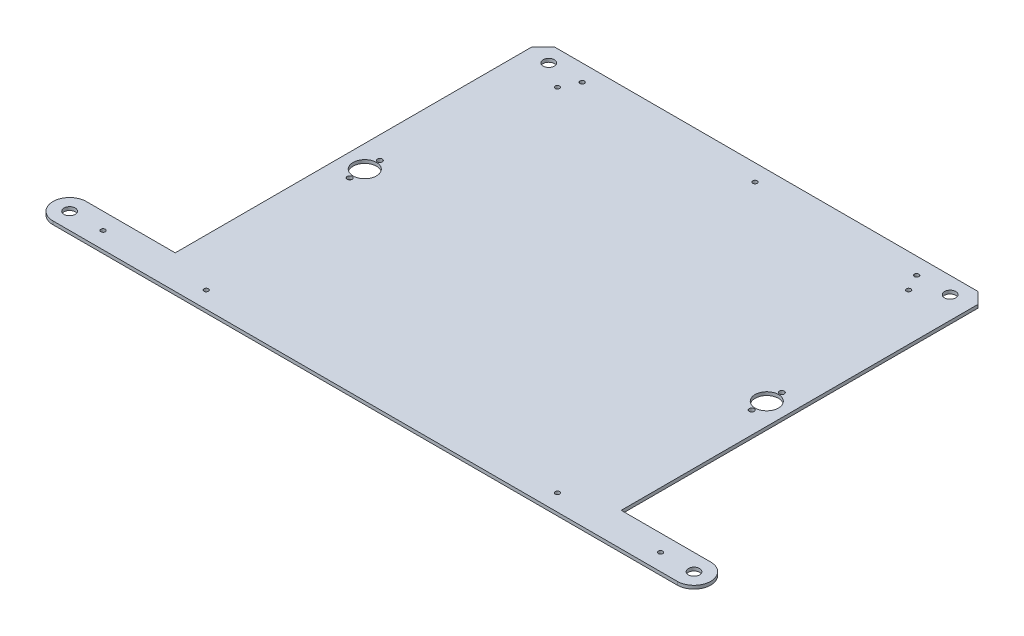
from build123d import *

# Parameters (mm, degrees)
SKETCH1_R           = 2
SKETCH1_R_2         = 5
SKETCH1_R_3         = 10.5
SKETCH1_R_4         = 2.25
BOSS_EXTRUDE1_DEPTH = 3
CHAMFER1_SIZE       = 10


with BuildPart() as part:
    # Sketch1 → Boss-Extrude1 (new body)
    with BuildSketch(Plane(origin=(0, 0, 0), x_dir=(1, 0, 0), z_dir=(0, 1, 0))):
        with BuildLine():
            Line((-200.2851606, -142.500000035), (-280, -142.500000035))
            ThreePointArc((-280, -142.500000035), (-294.999999965, -157.5), (-280, -172.499999965))
            Line((-280, -172.499999965), (280, -172.499999965))
            ThreePointArc((280, -172.499999965), (294.999999965, -157.5), (280, -142.500000035))
            Line((280, -142.500000035), (199.7148394, -142.500000035))
            Line((199.7148394, -142.500000035), (199.7148394, 187.499999965))
            Line((199.7148394, 187.499999965), (-200.2851606, 187.499999965))
            Line((-200.2851606, 187.499999965), (-200.2851606, -142.500000035))
        make_face()
        with Locations((-157.5, 157.5)):
            Circle(SKETCH1_R, mode=Mode.SUBTRACT)
        with Locations((157.5, 157.5)):
            Circle(SKETCH1_R, mode=Mode.SUBTRACT)
        with Locations((157.5, -157.5)):
            Circle(SKETCH1_R, mode=Mode.SUBTRACT)
        with Locations((-157.5, -157.5)):
            Circle(SKETCH1_R, mode=Mode.SUBTRACT)
        with Locations((-280, -157.5)):
            Circle(SKETCH1_R_2, mode=Mode.SUBTRACT)
        with Locations((280, -157.5)):
            Circle(SKETCH1_R_2, mode=Mode.SUBTRACT)
        with Locations((-250, -157.5)):
            Circle(SKETCH1_R, mode=Mode.SUBTRACT)
        with Locations((250, -157.5)):
            Circle(SKETCH1_R, mode=Mode.SUBTRACT)
        with Locations((-180.2851606, 172.499999965)):
            Circle(SKETCH1_R_2, mode=Mode.SUBTRACT)
        with Locations((179.7148394, 172.499999965)):
            Circle(SKETCH1_R_2, mode=Mode.SUBTRACT)
        with Locations((-150.2851606, 172.499999965)):
            Circle(SKETCH1_R, mode=Mode.SUBTRACT)
        with Locations((4.7148394, 172.499999965)):
            Circle(SKETCH1_R, mode=Mode.SUBTRACT)
        with Locations((149.7148394, 172.499999965)):
            Circle(SKETCH1_R, mode=Mode.SUBTRACT)
        with Locations((-180.2851606, 7.499999983)):
            Circle(SKETCH1_R_3, mode=Mode.SUBTRACT)
        with Locations((-180.2851606, 20.999999983)):
            Circle(SKETCH1_R_4, mode=Mode.SUBTRACT)
        with Locations((-180.2851606, -6.000000017)):
            Circle(SKETCH1_R_4, mode=Mode.SUBTRACT)
        with Locations((180.2851606, -6.000000017)):
            Circle(SKETCH1_R_4, mode=Mode.SUBTRACT)
        with Locations((180.2851606, 20.999999983)):
            Circle(SKETCH1_R_4, mode=Mode.SUBTRACT)
        with Locations((180.2851606, 7.499999983)):
            Circle(SKETCH1_R_3, mode=Mode.SUBTRACT)
    extrude(amount=BOSS_EXTRUDE1_DEPTH)

    # Chamfer1
    chamfer1_edges = [part.edges().sort_by_distance(p)[0] for p in [
        (199.7148394, 1.5, -187.499999965),
        (-200.2851606, 1.5, -187.499999965),
    ]]
    chamfer(chamfer1_edges, length=CHAMFER1_SIZE)


solid = part.part
